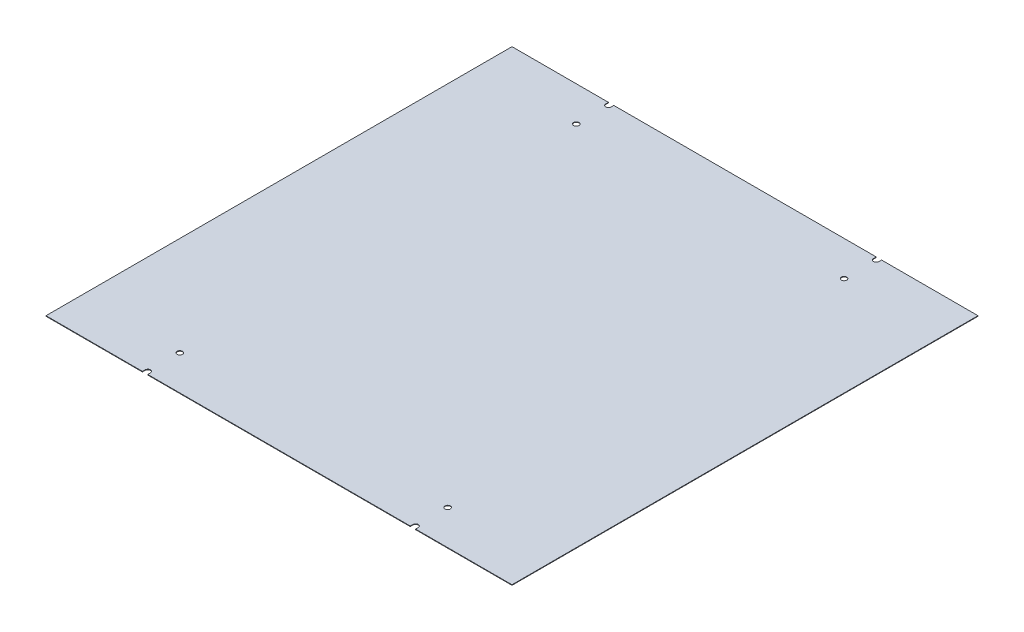
from build123d import *

# Parameters (mm, degrees)
SKETCH1_R           = 10
BOSS_EXTRUDE1_DEPTH = 2
FILLET1_R           = 10


with BuildPart() as part:
    # Sketch1 → Boss-Extrude1 (new body)
    with BuildSketch(Plane(origin=(0, 0, 0), x_dir=(1, 0, 0), z_dir=(0, 1, 0))):
        Polygon((490, -850), (490, -870), (-490, -870), (-490, -850), (-510, -850), (-510, -870), (-870, -870), (-870, 870), (-510, 870), (-510, 850), (-490, 850), (-490, 870), (490, 870), (490, 850), (510, 850), (510, 870), (870, 870), (870, -870), (510, -870), (510, -850), align=None)
        with Locations(Location((-500, 740, 0), (0, 0, 270))):
            Circle(SKETCH1_R, mode=Mode.SUBTRACT)
        with Locations(Location((500, 740, 0), (0, 0, 270))):
            Circle(SKETCH1_R, mode=Mode.SUBTRACT)
        with Locations(Location((500, -740, 0), (0, 0, 270))):
            Circle(SKETCH1_R, mode=Mode.SUBTRACT)
        with Locations(Location((-500, -740, 0), (0, 0, 270))):
            Circle(SKETCH1_R, mode=Mode.SUBTRACT)
    extrude(amount=BOSS_EXTRUDE1_DEPTH)

    # Fillet1
    fillet1_edges = [part.edges().sort_by_distance(p)[0] for p in [
        (490, 1, 850),
        (510, 1, 850),
        (-510, 1, 850),
        (-490, 1, 850),
        (510, 1, -850),
        (490, 1, -850),
        (-510, 1, -850),
        (-490, 1, -850),
    ]]
    fillet(fillet1_edges, radius=FILLET1_R - 0.0001)  # a hair under: the kernel refuses the full size


solid = part.part
